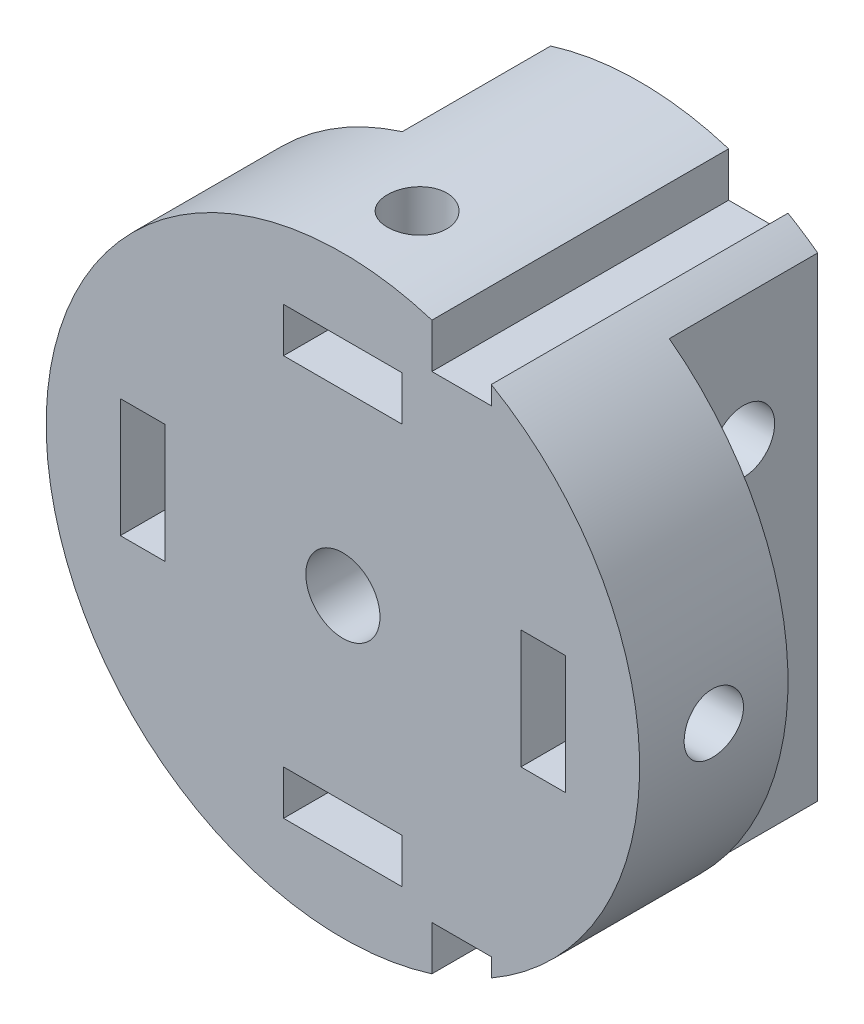
from build123d import *

# Parameters (mm, degrees)
SKETCH3_R                    = 25.4
SKETCH3_R_2                  = 3.175
BASE_DEPTH                   = 12.7
UPPER_BOLTS_CONNECTION_START = 12.7
SKETCH6_R                    = 3.175
UPPER_BOLTS_CONNECTION_DEPTH = 12.7
NUT_HOLE_DEPTH               = 8.89
UPPER_BOLTHOLES_REACH        = 45.552
SKETCH9_R                    = 2.667
NUT_RECESS_START             = -6.35
NUT_RECESS_DEPTH             = 3.81
SKETCH14_R                   = 2.54
RADIAL_BOLT_HOLE_DEPTH       = 15.24
CIRPATTERN2_COUNT            = 4
WIRE_PASSTHROUGH_REACH       = 45.994
SKETCH15_W                   = 5.08
SKETCH15_H                   = 3.81


with BuildPart() as part:
    # Sketch3 → base (new body)
    with BuildSketch(Plane(origin=(0, 0, 0), x_dir=(0, 1, 0), z_dir=(0, 0, 1))):
        Circle(SKETCH3_R)
        Circle(SKETCH3_R_2, mode=Mode.SUBTRACT)
    extrude(amount=BASE_DEPTH)

    # Sketch6 → upper_bolts_connection (add)
    with BuildSketch(Plane(origin=(0, 0, 0), x_dir=(1, 0, 0), z_dir=(0, 0, -1)).offset(UPPER_BOLTS_CONNECTION_START)):
        with BuildLine():
            Line((15.24, 20.32), (15.24, -20.32))
            ThreePointArc((15.24, -20.32), (4.282316421, -25.036408809), (-7.62, -24.230055716))
            Line((-7.62, -24.230055716), (-7.62, 24.230055716))
            ThreePointArc((-7.62, 24.230055716), (4.282316421, 25.036408809), (15.24, 20.32))
        make_face()
        Circle(SKETCH6_R, mode=Mode.SUBTRACT)
    extrude(amount=-UPPER_BOLTS_CONNECTION_DEPTH)

    # Sketch8 → nut_hole (cut)
    with BuildSketch(Plane(origin=(0, 0, -12.7), x_dir=(1, 0, 0), z_dir=(0, 0, -1))):
        Polygon((6.599113577, 0), (3.299556788, 5.715), (-3.299556788, 5.715), (-6.599113577, 0), (-3.299556788, -5.715), (3.299556788, -5.715), align=None)
    extrude(amount=-NUT_HOLE_DEPTH, mode=Mode.SUBTRACT)

    # Sketch9 → upper_boltholes (cut, up to next)
    with BuildSketch(Plane.ZY.offset(7.62), mode=Mode.PRIVATE) as upper_boltholes_sk1:
        with Locations((-6.35, -9.525)):
            Circle(SKETCH9_R)
    upper_boltholes_tool1 = extrude(upper_boltholes_sk1.sketch, amount=-UPPER_BOLTHOLES_REACH, mode=Mode.PRIVATE) & part.part
    # Sketch9 → upper_boltholes (cut, up to next)
    with BuildSketch(Plane.ZY.offset(7.62), mode=Mode.PRIVATE) as upper_boltholes_sk2:
        with Locations((-6.35, 9.525)):
            Circle(SKETCH9_R)
    upper_boltholes_tool2 = extrude(upper_boltholes_sk2.sketch, amount=-UPPER_BOLTHOLES_REACH, mode=Mode.PRIVATE) & part.part
    add(upper_boltholes_tool1.solids().sort_by_distance((-7.62, -9.525, -6.35))[0], mode=Mode.SUBTRACT)
    add(upper_boltholes_tool2.solids().sort_by_distance((-7.62, 9.525, -6.35))[0], mode=Mode.SUBTRACT)

    # Sketch13 → nut_recess (cut)
    with BuildSketch(Plane.ZY.offset(25.4).offset(NUT_RECESS_START)):
        Polygon((3.417060633, 5.08), (0.484121265, 0), (3.417060633, -5.08), (12.7, -5.08), (12.7, 5.08), align=None)
    nut_recess = extrude(amount=-NUT_RECESS_DEPTH, mode=Mode.SUBTRACT)

    # Sketch14 → radial_bolt_hole (cut)
    with BuildSketch(Plane.ZY.offset(25.4)):
        with Locations((6.35, 0)):
            Circle(SKETCH14_R)
    radial_bolt_hole = extrude(amount=-RADIAL_BOLT_HOLE_DEPTH, mode=Mode.SUBTRACT)

    # CirPattern2: nut_recess, radial_bolt_hole ×4 about axis
    cirpattern2_axis = Axis((0, 0, 12.7), (0, 0, -1))
    add([nut_recess.rotate(cirpattern2_axis, i * 360 / CIRPATTERN2_COUNT) for i in range(1, CIRPATTERN2_COUNT)], mode=Mode.SUBTRACT)
    add([radial_bolt_hole.rotate(cirpattern2_axis, i * 360 / CIRPATTERN2_COUNT) for i in range(1, CIRPATTERN2_COUNT)], mode=Mode.SUBTRACT)

    # Sketch15 → wire_passthrough (cut, up to next)
    with BuildSketch(Plane(origin=(0, 0, -12.7), x_dir=(1, 0, 0), z_dir=(0, 0, -1)), mode=Mode.PRIVATE) as wire_passthrough_sk1:
        with Locations((10.16, 22.325055716)):
            Rectangle(SKETCH15_W, SKETCH15_H)
    wire_passthrough_tool1 = extrude(wire_passthrough_sk1.sketch, amount=-WIRE_PASSTHROUGH_REACH, mode=Mode.PRIVATE) & part.part
    wire_passthrough = wire_passthrough_tool1.solids().sort_by_distance((10.16, -22.325056, -12.7))[0]
    add(wire_passthrough, mode=Mode.SUBTRACT)

    # wire_passthrough_mirror: wire_passthrough across plane
    add(wire_passthrough.mirror(Plane.ZX), mode=Mode.SUBTRACT)


solid = part.part
